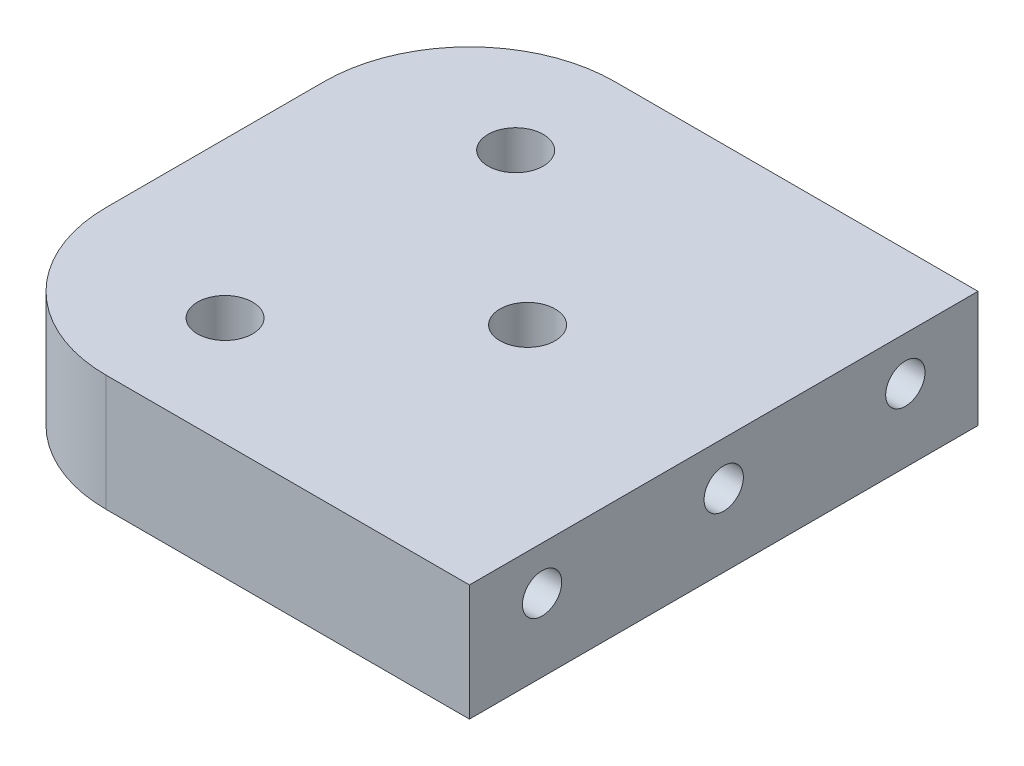
from build123d import *

# Parameters (mm, degrees)
SKETCH1_W                 = 35
SKETCH1_H                 = 35
BOSS_EXTRUDE1_DEPTH       = 8
F_6_32_TAPPED_HOLE1_D     = 2.7051
F_6_32_TAPPED_HOLE1_DEPTH = 9.39
F_6_32_TAPPED_HOLE1_TIP   = 0.81269403
F_6_CLEARANCE_HOLE1_D     = 3.7973
FILLET1_R                 = 10


with BuildPart() as part:
    # Sketch1 → Boss-Extrude1 (new body)
    with BuildSketch(Plane(origin=(0, 0, 0), x_dir=(1, 0, 0), z_dir=(0, 1, 0))):
        Rectangle(SKETCH1_W, SKETCH1_H)
    extrude(amount=BOSS_EXTRUDE1_DEPTH)

    # #6-32 Tapped Hole1
    with Locations(Plane(origin=(17.5, 0, 0), x_dir=(0, 0, -1), z_dir=(1, 0, 0))):
        with Locations((-12.5, 5), (0, 5), (12.5, 5)):
            Hole(F_6_32_TAPPED_HOLE1_D / 2, depth=F_6_32_TAPPED_HOLE1_DEPTH)
            with Locations((0, 0, -(F_6_32_TAPPED_HOLE1_DEPTH + F_6_32_TAPPED_HOLE1_TIP / 2))):  # 118° drill point
                Cone(0, F_6_32_TAPPED_HOLE1_D / 2, F_6_32_TAPPED_HOLE1_TIP, mode=Mode.SUBTRACT)

    # #6 Clearance Hole1 (through all)
    with Locations(Plane(origin=(0, 8, 0), x_dir=(1, 0, 0), z_dir=(0, 1, 0))):
        with Locations((4, 0), (-6.82, 10), (-6.82, -10)):
            Hole(F_6_CLEARANCE_HOLE1_D / 2)

    # Fillet1
    fillet1_edges = [part.edges().sort_by_distance(p)[0] for p in [
        (-17.5, 4, 17.5),
        (-17.5, 4, -17.5),
    ]]
    fillet(fillet1_edges, radius=FILLET1_R)


solid = part.part
